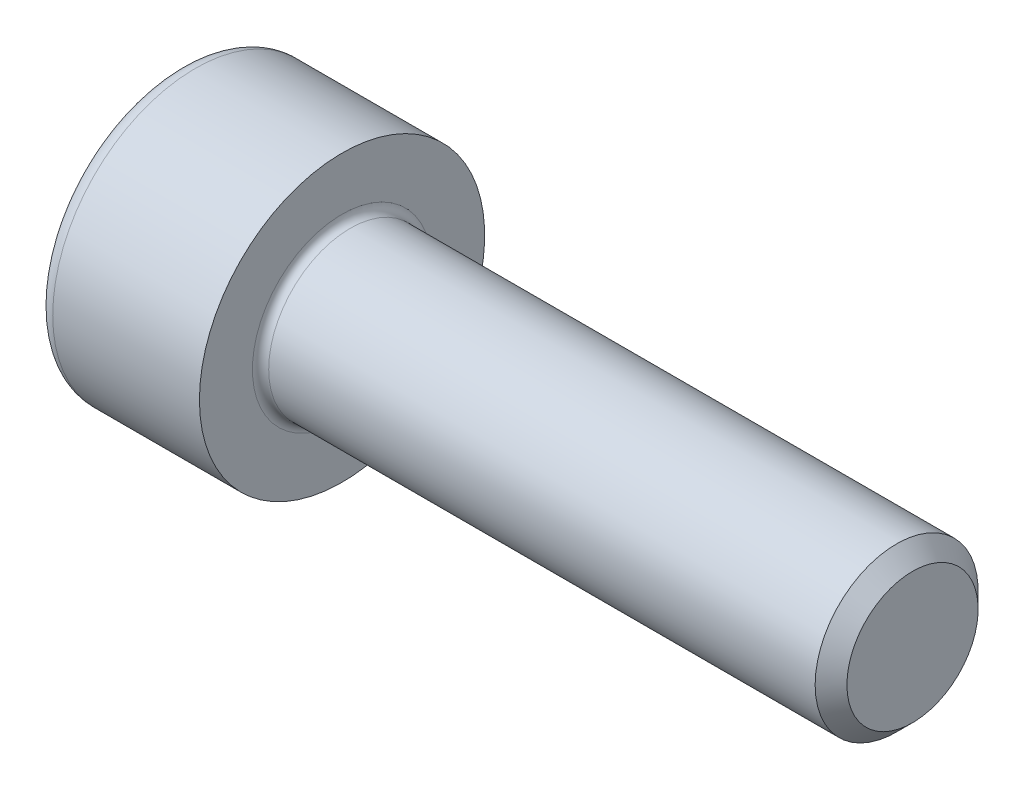
from build123d import *

# Parameters (mm, degrees)
FILLET1_R   = 0.2
FILLET2_R   = 0.4
HEX_2_DEPTH = 2


with BuildPart() as part:
    # BodySke → Base-Revolve (revolve)
    with BuildSketch(Plane.XY):
        Polygon((0, 0), (0, 3.5), (4, 3.5), (4, 2), (17.61, 2), (18, 1.61), (18, 0), align=None)
    revolve(axis=Axis((-31.75, 0, 0), (1, 0, 0)))

    # Fillet1
    fillet1_edges = [part.edges().sort_by_distance(p)[0] for p in [
        (4, -2, 0),
    ]]
    fillet(fillet1_edges, radius=FILLET1_R)

    # Fillet2
    fillet2_edges = [part.edges().sort_by_distance(p)[0] for p in [
        (0, -3.5, 0),
    ]]
    fillet(fillet2_edges, radius=FILLET2_R)

    # Sketch2 → Hex-PreBroach (revolve, cut)
    with BuildSketch(Plane.XY):
        Polygon((0, 1.51), (2, 1.51), (2.871798906, 0), (0, 0), align=None)
    revolve(axis=Axis((0, 0, 0), (1, 0, 0)), mode=Mode.SUBTRACT)

    # Sketch3 → Hex 2 (cut)
    with BuildSketch(Plane(origin=(0, 0, 0), x_dir=(0, 0.500000000000001, 0.866025403784438), z_dir=(-1, 0, 0))):
        Polygon((0.871798906, 1.51), (-0.871798906, 1.51), (-1.743597813, 0), (-0.871798906, -1.51), (0.871798906, -1.51), (1.743597813, 0), align=None)
    extrude(amount=-HEX_2_DEPTH, mode=Mode.SUBTRACT)


solid = part.part
